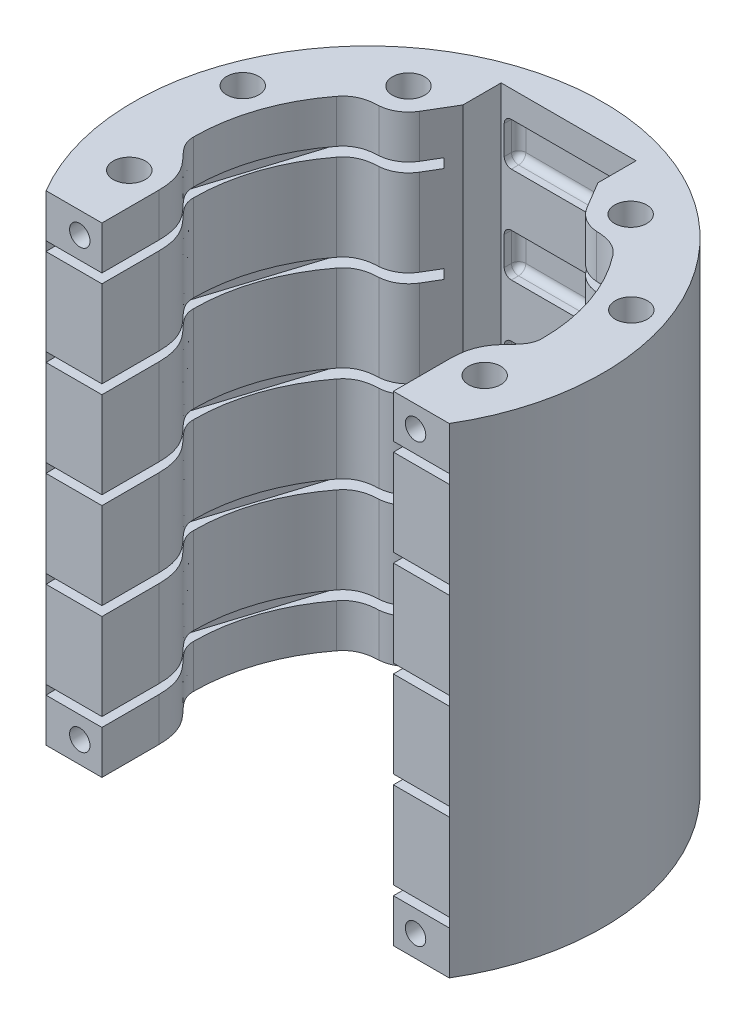
from build123d import *

# Parameters (mm, degrees)
SKETCH1_R               = 3.35
BOSS_EXTRUDE2_DEPTH     = 100
SLOT_DEPTH              = 0.975
SKETCH2_W               = 26.816340448
SKETCH2_H               = 8.966153582
CUT_EXTRUDE1_DEPTH      = 3
FILLET1_R               = 1.5
LPATTERN1_COUNT         = 5
LPATTERN1_PITCH         = 20
FILLET1_OF_LPATTERN1_R  = 1.5
SKETCH7_R               = 2.125
CUT_EXTRUDE2_DEPTH      = 8
MIRROR2_COPY_1_SKETCH_R = 2.125
MIRROR2_COPY_1_DEPTH    = 8


with BuildPart() as part:
    # Sketch1 → Boss-Extrude2 (new body)
    with BuildSketch(Plane(origin=(0, 0, 0), x_dir=(1, 0, 0), z_dir=(0, 1, 0))):
        with BuildLine():
            Line((-41.978758021, -25.07), (-30.348758021, -25.07))
            Line((-30.348758021, -25.07), (-30.348758021, -13.232808954))
            add(Edge.make_bspline(
                [(-30.348758021, -13.232808954), (-30.348758021, -4.818714921), (-36.33, -4.744134389), (-36.33, 0)],
                knots=[0, 0, 0, 0, 1, 1, 1, 1], degree=3))
            ThreePointArc((-36.33, 0), (-34.39042699, 11.711850043), (-28.778806418, 22.173163986))
            add(Edge.make_bspline(
                [(-28.778806418, 22.173163986), (-26.803037595, 24.859102931), (-22.681011433, 24.921676571)],
                knots=[0, 0, 0, 1, 1, 1], degree=2))
            ThreePointArc((-22.681011433, 24.921676571), (-19.650237351, 25.889455066), (-17.415892192, 28.154380775))
            Line((-17.415892192, 28.154380775), (-14.05, 33.807342135))
            Line((-14.05, 33.807342135), (-14.05, 41.76))
            Line((-14.05, 41.76), (14.05, 41.76))
            Line((14.05, 41.76), (14.05, 33.807342135))
            Line((14.05, 33.807342135), (17.415892192, 28.154380775))
            ThreePointArc((17.415892192, 28.154380775), (19.650237351, 25.889455066), (22.681011433, 24.921676571))
            add(Edge.make_bspline(
                [(28.778806418, 22.173163986), (26.803037595, 24.859102931), (22.681011433, 24.921676571)],
                knots=[0, 0, 0, 1, 1, 1], degree=2))
            ThreePointArc((28.778806418, 22.173163986), (34.39042699, 11.711850043), (36.33, 0))
            add(Edge.make_bspline(
                [(30.348758021, -13.232808954), (30.348758021, -4.818714921), (36.33, -4.744134389), (36.33, 0)],
                knots=[0, 0, 0, 0, 1, 1, 1, 1], degree=3))
            Line((30.348758021, -13.232808954), (30.348758021, -25.07))
            Line((30.348758021, -25.07), (41.978758021, -25.07))
            ThreePointArc((41.978758021, -25.07), (0, 48.895), (-41.978758021, -25.07))
        make_face()
        with Locations((-37.000474826, -12.718618748)):
            Circle(SKETCH1_R, mode=Mode.SUBTRACT)
        with Locations((37.000474826, -12.718618748)):
            Circle(SKETCH1_R, mode=Mode.SUBTRACT)
        with Locations((-40.457027923, 14.360145949)):
            Circle(SKETCH1_R, mode=Mode.SUBTRACT)
        with Locations((-23.129730363, 31.556520301)):
            Circle(SKETCH1_R, mode=Mode.SUBTRACT)
        with Locations((40.457027923, 14.360145949)):
            Circle(SKETCH1_R, mode=Mode.SUBTRACT)
        with Locations((23.129730363, 31.556520301)):
            Circle(SKETCH1_R, mode=Mode.SUBTRACT)
    extrude(amount=BOSS_EXTRUDE2_DEPTH)

    # Sketch6 → slot (cut, symmetric)
    with BuildSketch(Plane(origin=(0, 10, 0), x_dir=(-1, 0, 0), z_dir=(0, -1, 0))):
        with BuildLine():
            Line((41.978758021, -25.07), (42.348021617, -12.880616636))
            ThreePointArc((42.348021617, -12.880616636), (42.300596018, -11.989773536), (42.105800179, -11.119196027))
            Line((42.105800179, -11.119196027), (28.235055716, 33.155943022))
            ThreePointArc((28.235055716, 33.155943022), (24.341289072, 36.767530328), (19.253636812, 35.244120983))
            Line((19.253636812, 35.244120983), (13.047964359, 28.721243631))
            ThreePointArc((13.047964359, 28.721243631), (12.816725989, 28.560405037), (12.540811932, 28.50373344))
            Line((12.540811932, 28.50373344), (10.657647051, 28.50373344))
            ThreePointArc((10.657647051, 28.50373344), (10.516225695, 28.562312083), (10.457647051, 28.70373344))
            Line((10.457647051, 28.70373344), (10.457647051, 36.268969967))
            Line((10.457647051, 36.268969967), (9.766617018, 36.96))
            Line((9.766617018, 36.96), (-0.68191112, 36.96))
            Line((-0.68191112, 36.96), (-1.357647051, 36.284264069))
            Line((-1.357647051, 36.284264069), (-1.357647051, 29.218375638))
            ThreePointArc((-1.357647051, 29.218375638), (-2.007647051, 28.607259567), (-2.657647051, 29.218375638))
            Line((-2.657647051, 29.218375638), (-2.657647051, 36.284264069))
            Line((-2.657647051, 36.284264069), (-3.333382982, 36.96))
            Line((-3.333382982, 36.96), (-9.78191112, 36.96))
            Line((-9.78191112, 36.96), (-10.457647051, 36.284264069))
            Line((-10.457647051, 36.284264069), (-10.457647051, 28.70373344))
            ThreePointArc((-10.457647051, 28.70373344), (-10.516225695, 28.562312083), (-10.657647051, 28.50373344))
            Line((-10.657647051, 28.50373344), (-12.540811932, 28.50373344))
            ThreePointArc((-12.540811932, 28.50373344), (-12.816725989, 28.560405037), (-13.047964359, 28.721243631))
            Line((-13.047964359, 28.721243631), (-19.253636812, 35.244120983))
            ThreePointArc((-19.253636812, 35.244120983), (-24.341289072, 36.767530328), (-28.235055716, 33.155943022))
            Line((-28.235055716, 33.155943022), (-42.105800179, -11.119196027))
            ThreePointArc((-42.105800179, -11.119196027), (-42.300596018, -11.989773536), (-42.348021617, -12.880616636))
            Line((-42.348021617, -12.880616636), (-41.978758021, -25.07))
            Line((-41.978758021, -25.07), (41.978758021, -25.07))
        make_face()
    slot = extrude(amount=SLOT_DEPTH, both=True, mode=Mode.SUBTRACT)

    # Sketch2 → Cut-Extrude1 (cut)
    with BuildSketch(Plane.XY.offset(-41.76)):
        with Locations((0, 10)):
            Rectangle(SKETCH2_W, SKETCH2_H)
    cut_extrude1 = extrude(amount=-CUT_EXTRUDE1_DEPTH, mode=Mode.SUBTRACT)

    # Fillet1
    fillet1_edges = [part.edges().sort_by_distance(p)[0] for p in [
        (0, 14.483076791, -44.76),
        (13.408170224, 10, -44.76),
        (0, 5.516923209, -44.76),
        (-13.408170224, 10, -44.76),
        (13.408170224, 5.516923209, -43.26),
        (13.408170224, 14.483076791, -43.26),
        (-13.408170224, 14.483076791, -43.26),
        (-13.408170224, 5.516923209, -43.26),
    ]]
    fillet(fillet1_edges, radius=FILLET1_R)

    # LPattern1: slot, Cut-Extrude1 ×5
    with Locations(*[(0, i * LPATTERN1_PITCH, 0) for i in range(1, LPATTERN1_COUNT)]):
        add(slot, mode=Mode.SUBTRACT)
        add(cut_extrude1, mode=Mode.SUBTRACT)

    # Fillet1 of LPattern1
    fillet1_of_lpattern1_edges = [part.edges().sort_by_distance(p)[0] for p in [
        (0, 34.483076791, -44.76),
        (13.408170224, 30, -44.76),
        (0, 25.516923209, -44.76),
        (-13.408170224, 30, -44.76),
        (13.408170224, 25.516923209, -43.26),
        (13.408170224, 34.483076791, -43.26),
        (-13.408170224, 34.483076791, -43.26),
        (-13.408170224, 25.516923209, -43.26),
        (0, 54.483076791, -44.76),
        (13.408170224, 50, -44.76),
        (0, 45.516923209, -44.76),
        (-13.408170224, 50, -44.76),
        (13.408170224, 45.516923209, -43.26),
        (13.408170224, 54.483076791, -43.26),
        (-13.408170224, 54.483076791, -43.26),
        (-13.408170224, 45.516923209, -43.26),
        (0, 74.483076791, -44.76),
        (13.408170224, 70, -44.76),
        (0, 65.516923209, -44.76),
        (-13.408170224, 70, -44.76),
        (13.408170224, 65.516923209, -43.26),
        (13.408170224, 74.483076791, -43.26),
        (-13.408170224, 74.483076791, -43.26),
        (-13.408170224, 65.516923209, -43.26),
        (0, 94.483076791, -44.76),
        (13.408170224, 90, -44.76),
        (0, 85.516923209, -44.76),
        (-13.408170224, 90, -44.76),
        (13.408170224, 85.516923209, -43.26),
        (13.408170224, 94.483076791, -43.26),
        (-13.408170224, 94.483076791, -43.26),
        (-13.408170224, 85.516923209, -43.26),
    ]]
    fillet(fillet1_of_lpattern1_edges, radius=FILLET1_OF_LPATTERN1_R)

    # Sketch7 → Cut-Extrude2 (cut)
    with BuildSketch(Plane.XY.offset(25.07)):
        with Locations((34.962080117, 4.5125)):
            Circle(SKETCH7_R)
    cut_extrude2 = extrude(amount=-CUT_EXTRUDE2_DEPTH, mode=Mode.SUBTRACT)

    # Mirror1: Cut-Extrude2 across plane
    add(cut_extrude2.mirror(Plane(origin=(0, 0, 0), x_dir=(0, 0, 1), z_dir=(1, 0, 0))), mode=Mode.SUBTRACT)

    # Mirror2: Cut-Extrude2 across plane
    add(cut_extrude2.mirror(Plane(origin=(0, 50, 0), x_dir=(0, 0, 1), z_dir=(0, -1, 0))), mode=Mode.SUBTRACT)

    # Mirror2 copy 1 sketch → Mirror2 copy 1 (cut)
    with BuildSketch(Plane(origin=(0, 100, 25.07), x_dir=(-1, 0, 0), z_dir=(0, 0, 1))):
        with Locations((34.962080117, 4.5125)):
            Circle(MIRROR2_COPY_1_SKETCH_R)
    extrude(amount=-MIRROR2_COPY_1_DEPTH, mode=Mode.SUBTRACT)


solid = part.part
